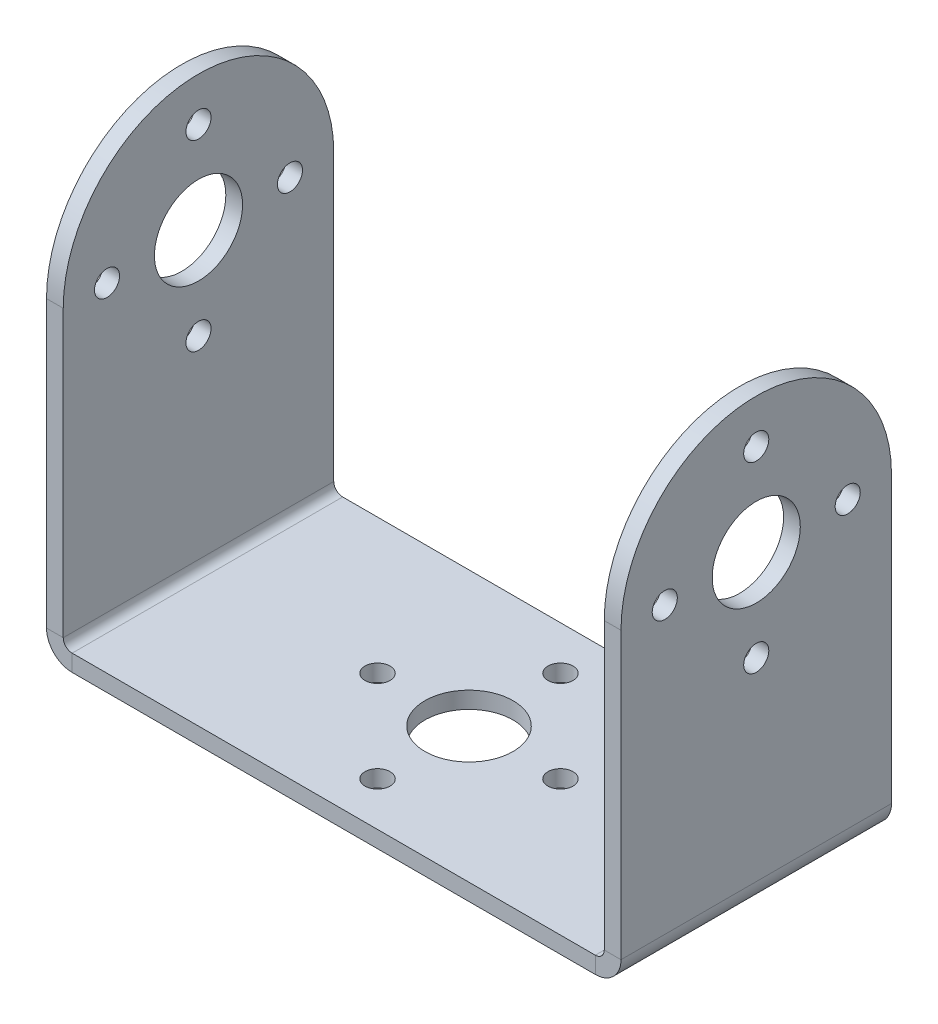
from build123d import *

# Parameters (mm, degrees)
BASE_FLANGE1_DEPTH = 12.319
FILLET1_RADIUS     = 12.319
FILLET1_LENGTH     = 1.524
FILLET2_RADIUS     = 12.319
FILLET2_LENGTH     = 1.524
SKETCH3_R          = 4.0132
SKETCH3_R_2        = 1.143
EXTRUDE1_DEPTH     = 68.388191377
SKETCH4_R          = 4.0132
SKETCH4_R_2        = 1.143
EXTRUDE2_DEPTH     = 1.524


# Sheet-metal steps are written as plain solids
with BuildPart() as part:
    # Sketch1 → Base-Flange1 (new, symmetric)
    with BuildSketch(Plane.XY):
        with BuildLine():
            Line((-26.162, 40.64), (-26.162, 2.3368))
            ThreePointArc((-26.162, 2.3368), (-25.477567126, 0.684432874), (-23.8252, 0))
            Line((-23.8252, 0), (23.8252, 0))
            ThreePointArc((23.8252, 0), (25.477567126, 0.684432874), (26.162, 2.3368))
            Line((26.162, 2.3368), (26.162, 40.64))
            Line((26.162, 40.64), (24.638, 40.64))
            Line((24.638, 40.64), (24.638, 2.3368))
            ThreePointArc((24.638, 2.3368), (24.399936392, 1.762063608), (23.8252, 1.524))
            Line((23.8252, 1.524), (-23.8252, 1.524))
            ThreePointArc((-23.8252, 1.524), (-24.399936392, 1.762063608), (-24.638, 2.3368))
            Line((-24.638, 2.3368), (-24.638, 40.64))
            Line((-24.638, 40.64), (-26.162, 40.64))
        make_face()
    extrude(amount=BASE_FLANGE1_DEPTH, both=True)

    # Fillet1: full round fillet: the end face becomes a half cylinder, R = half its width
    fillet1_face = Plane((-25.4, 40.64, 0), x_dir=(-1, 0, 0), z_dir=(0, 1, 0))  # on the end face: x along it, z out of the body
    fillet1_slab = fillet1_face.offset(-FILLET1_RADIUS / 2) * Box(FILLET1_LENGTH, 2 * FILLET1_RADIUS, FILLET1_RADIUS, mode=Mode.PRIVATE)  # the body's end, R deep
    fillet1_round = Plane((-25.4, 28.321, 0), x_dir=(0, 1, 0), z_dir=(-1, 0, 0)) * Cylinder(FILLET1_RADIUS, FILLET1_LENGTH, mode=Mode.PRIVATE)  # its axis R under the face
    add(fillet1_slab - fillet1_round, mode=Mode.SUBTRACT)

    # Fillet2: full round fillet: the end face becomes a half cylinder, R = half its width
    fillet2_face = Plane((25.4, 40.64, 0), x_dir=(-1, 0, 0), z_dir=(0, 1, 0))  # on the end face: x along it, z out of the body
    fillet2_slab = fillet2_face.offset(-FILLET2_RADIUS / 2) * Box(FILLET2_LENGTH, 2 * FILLET2_RADIUS, FILLET2_RADIUS, mode=Mode.PRIVATE)  # the body's end, R deep
    fillet2_round = Plane((25.4, 28.321, 0), x_dir=(0, 1, 0), z_dir=(-1, 0, 0)) * Cylinder(FILLET2_RADIUS, FILLET2_LENGTH, mode=Mode.PRIVATE)  # its axis R under the face
    add(fillet2_slab - fillet2_round, mode=Mode.SUBTRACT)

    # Sketch3 → Extrude1 (cut, through all)
    with BuildSketch(Plane(origin=(26.162, 0, 0), x_dir=(0, 0, -1), z_dir=(1, 0, 0))):
        with Locations((0, 28.321)):
            Circle(SKETCH3_R)
        with Locations((0, 36.6522)):
            Circle(SKETCH3_R_2)
        with Locations((8.3312, 28.321)):
            Circle(SKETCH3_R_2)
        with Locations((0, 19.9898)):
            Circle(SKETCH3_R_2)
        with Locations((-8.3312, 28.321)):
            Circle(SKETCH3_R_2)
    extrude(amount=-EXTRUDE1_DEPTH, mode=Mode.SUBTRACT)

    # Sketch4 → Extrude2 (cut)
    with BuildSketch(Plane(origin=(0, 1.524, 0), x_dir=(1, 0, 0), z_dir=(0, 1, 0))):
        with Locations(Location((0, 0, 0), (0, 0, 270))):
            Circle(SKETCH4_R)
        with Locations(Location((0, 8.3312, 0), (0, 0, 270))):
            Circle(SKETCH4_R_2)
        with Locations(Location((8.3312, 0, 0), (0, 0, 270))):
            Circle(SKETCH4_R_2)
        with Locations(Location((0, -8.3312, 0), (0, 0, 270))):
            Circle(SKETCH4_R_2)
        with Locations(Location((-8.3312, 0, 0), (0, 0, 270))):
            Circle(SKETCH4_R_2)
    extrude(amount=-EXTRUDE2_DEPTH, mode=Mode.SUBTRACT)


solid = part.part
